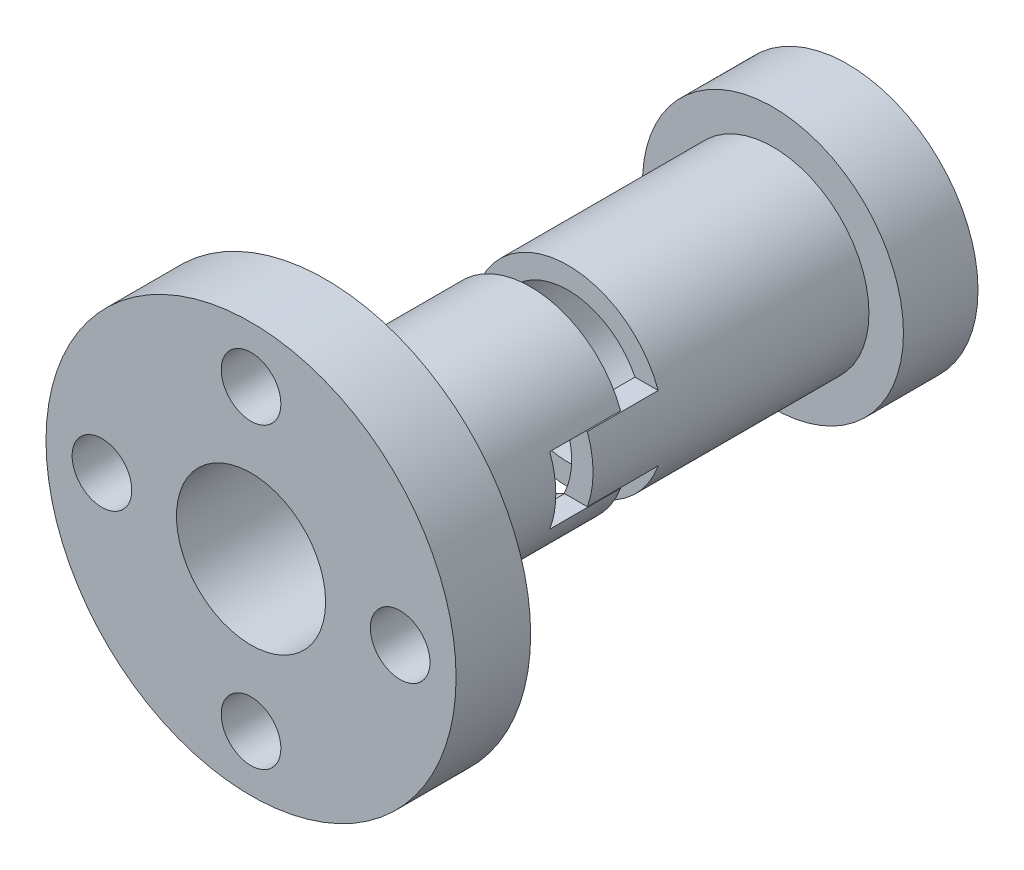
from build123d import *

# Parameters (mm, degrees)
MATRIZC1_COUNT             = 4
CORTAR_EXTRUIR1_DEPTH      = 36.580893749
CORTAR_EXTRUIR1_DEPTH_BACK = 36.580893749


with BuildPart() as part:
    # Croquis1 → Revolución1 (revolve)
    with BuildSketch(Plane(origin=(0, 0, 0), x_dir=(0, 0, -1), z_dir=(1, 0, 0))):
        Polygon((0, 4), (0, 11), (4, 11), (4, 5.15), (28, 5.15), (28, 7), (32, 7), (32, 4), align=None)
    revolve(axis=Axis((0, 0, 0), (0, 0, -1)))

    # Croquis3 → Taladro de margen para M31 (revolve, cut)
    with BuildSketch(Plane(origin=(8, 0, 0), x_dir=(0, -1, 0), z_dir=(1, 0, 0))):
        Polygon((0, 0), (0, 8.6), (1.6, 7), (1.6, 0), align=None)
    taladro_de_margen_para_m31 = revolve(axis=Axis((8, 0, 6.35), (0, 0, -1)), mode=Mode.SUBTRACT)

    # MatrizC1: Taladro de margen para M31 ×4 about axis
    matrizc1_axis = Axis((0, 0, 0), (0, 0, -1))
    for i in range(1, MATRIZC1_COUNT):
        add(taladro_de_margen_para_m31.rotate(matrizc1_axis, i * 360 / MATRIZC1_COUNT), mode=Mode.SUBTRACT)

    # Croquis4 → Cortar-Extruir1 (cut, two sides: drawn at the far end of the back side and taken through both)
    with BuildSketch(Plane(origin=(0, 0, 0), x_dir=(0, 0, -1), z_dir=(1, 0, 0)).offset(-CORTAR_EXTRUIR1_DEPTH_BACK)):
        Polygon((11.2, -1.8), (15, -1.8), (15, -5.15), (17, -5.15), (17, -1.75), (13.2, -1.75), (13.2, 1.75), (17, 1.75), (17, 5.15), (15, 5.15), (15, 1.8), (11.2, 1.8), align=None)
    extrude(amount=CORTAR_EXTRUIR1_DEPTH + CORTAR_EXTRUIR1_DEPTH_BACK, mode=Mode.SUBTRACT)


with BuildPart() as cortar_extruir1_piece_1:
    # of the separate pieces the step leaves, piece 1, a body of its own (cortar_extruir1_pieces)
    add(part.part.solids().sort_by_distance((0, 11, 0))[0])


with BuildPart() as cortar_extruir1_piece_2:
    # of the separate pieces the step leaves, piece 2, a body of its own (cortar_extruir1_pieces)
    add(part.part.solids().sort_by_distance((0, 4, -32))[0])


solid = Compound([cortar_extruir1_piece_1.part, cortar_extruir1_piece_2.part])
